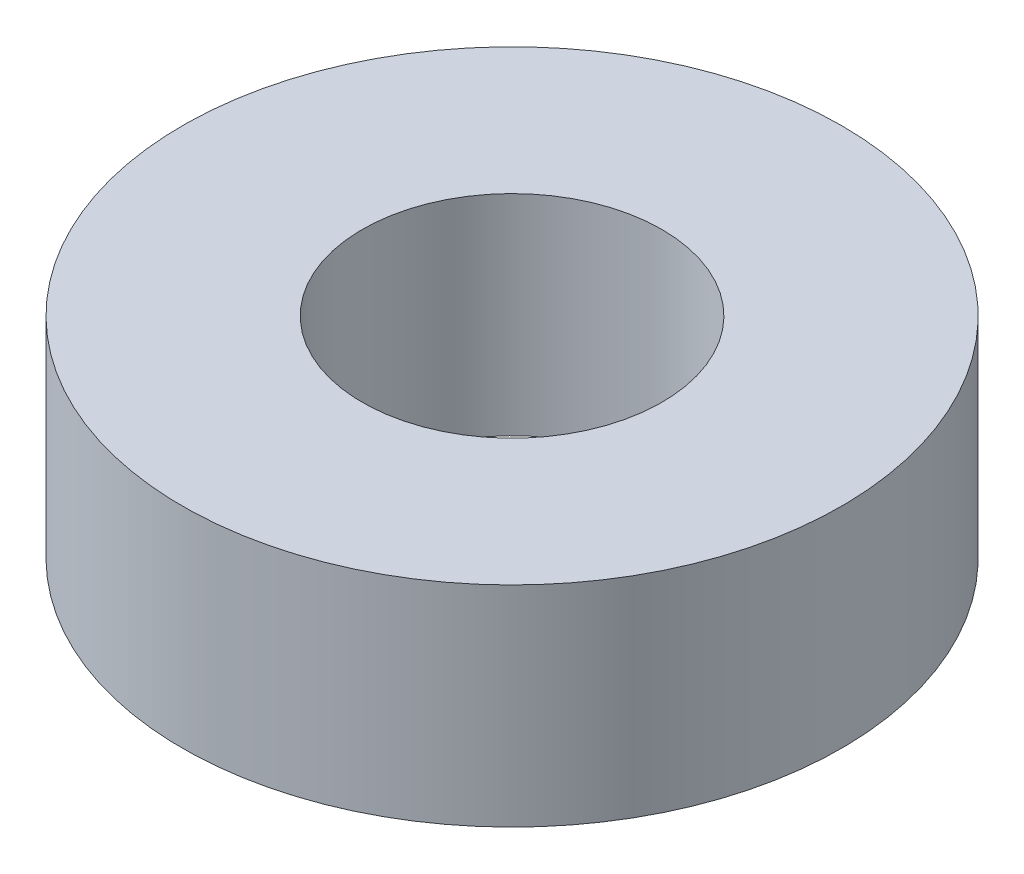
from build123d import *

# Parameters (mm, degrees)
SKETCH1_W = 6
SKETCH1_H = 7


with BuildPart() as part:
    # Sketch1 → Revolve1 (revolve)
    with BuildSketch(Plane.XY):
        with Locations((8, 3.5)):
            Rectangle(SKETCH1_W, SKETCH1_H)
    revolve(axis=Axis((0, 0, 0), (0, 1, 0)))


solid = part.part
